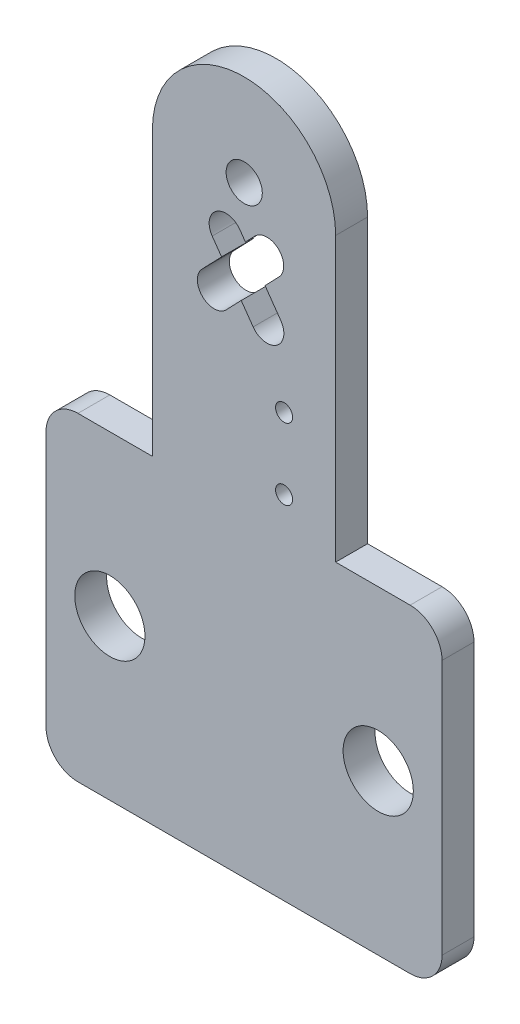
from build123d import *

# Parameters (mm, degrees)
BOSS_EXTRUDE1_DEPTH     = 3
M3_CLEARANCE_HOLE1_D    = 3.4
M6_CLEARANCE_HOLE1_D    = 6.6
FILLET1_R               = 3
CUT_EXTRUDE1_DEPTH      = 10
TAP_DRILL_FOR_M2_TAP1_D = 1.6


with BuildPart() as part:
    # Sketch1 → Boss-Extrude1 (new body)
    with BuildSketch(Plane.XY):
        with BuildLine():
            Line((50.773782993, 15), (50.773782993, 41.5958))
            ThreePointArc((50.773782993, 41.5958), (59.386891497, 50.208908503), (68, 41.5958))
            Line((68, 41.5958), (68, 15))
            Line((68, 15), (78, 15))
            Line((78, 15), (78, -15))
            Line((78, -15), (40.773782993, -15))
            Line((40.773782993, -15), (40.773782993, 15))
            Line((40.773782993, 15), (50.773782993, 15))
        make_face()
    extrude(amount=BOSS_EXTRUDE1_DEPTH)

    # M3 Clearance Hole1 (through all)
    with Locations(Plane.XY.offset(3)):
        with Locations((59.40350934, 41.5958)):
            Hole(M3_CLEARANCE_HOLE1_D / 2)

    # M6 Clearance Hole1 (through all)
    with Locations(Plane.XY.offset(3)):
        with Locations((46.773782993, 0), (72, 0)):
            Hole(M6_CLEARANCE_HOLE1_D / 2)

    # Fillet1
    fillet1_edges = [part.edges().sort_by_distance(p)[0] for p in [
        (78, -15, 1.5),
        (40.773782993, -15, 1.5),
        (40.773782993, 15, 1.5),
        (78, 15, 1.5),
    ]]
    fillet(fillet1_edges, radius=FILLET1_R)

    # Sketch6 → Cut-Extrude1 (cut)
    with BuildSketch(Plane(origin=(0, 0, 0), x_dir=(-1, 0, 0), z_dir=(0, 0, -1))):
        with BuildLine():
            Line((-60.242174181, 30.268733642), (-59.121027546, 31.863253301))
            Line((-59.121027546, 31.863253301), (-57.71168669, 30.397005642))
            ThreePointArc((-57.71168669, 30.397005642), (-55.484660039, 30.352933632), (-55.440588029, 32.579960282))
            Line((-55.440588029, 32.579960282), (-57.275110449, 34.488557618))
            Line((-57.275110449, 34.488557618), (-56.394829681, 35.740512487))
            ThreePointArc((-56.394829681, 35.740512487), (-56.780357876, 37.952226869), (-58.992072259, 37.566698674))
            Line((-58.992072259, 37.566698674), (-59.516660479, 36.820617651))
            Line((-59.516660479, 36.820617651), (-60.40524614, 37.7450829))
            ThreePointArc((-60.40524614, 37.7450829), (-62.63227279, 37.789154911), (-62.6763448, 35.562128261))
            Line((-62.6763448, 35.562128261), (-61.362577576, 34.195313335))
            Line((-61.362577576, 34.195313335), (-62.839416759, 32.09491983))
            ThreePointArc((-62.839416759, 32.09491983), (-62.453888564, 29.883205447), (-60.242174181, 30.268733642))
        make_face()
    extrude(amount=-CUT_EXTRUDE1_DEPTH, mode=Mode.SUBTRACT)

    # Tap Drill for M2 Tap1 (through all)
    with Locations(Plane.XY.offset(3)):
        with Locations((63.15, 24.765), (63.15, 18.065)):
            Hole(TAP_DRILL_FOR_M2_TAP1_D / 2)


solid = part.part
